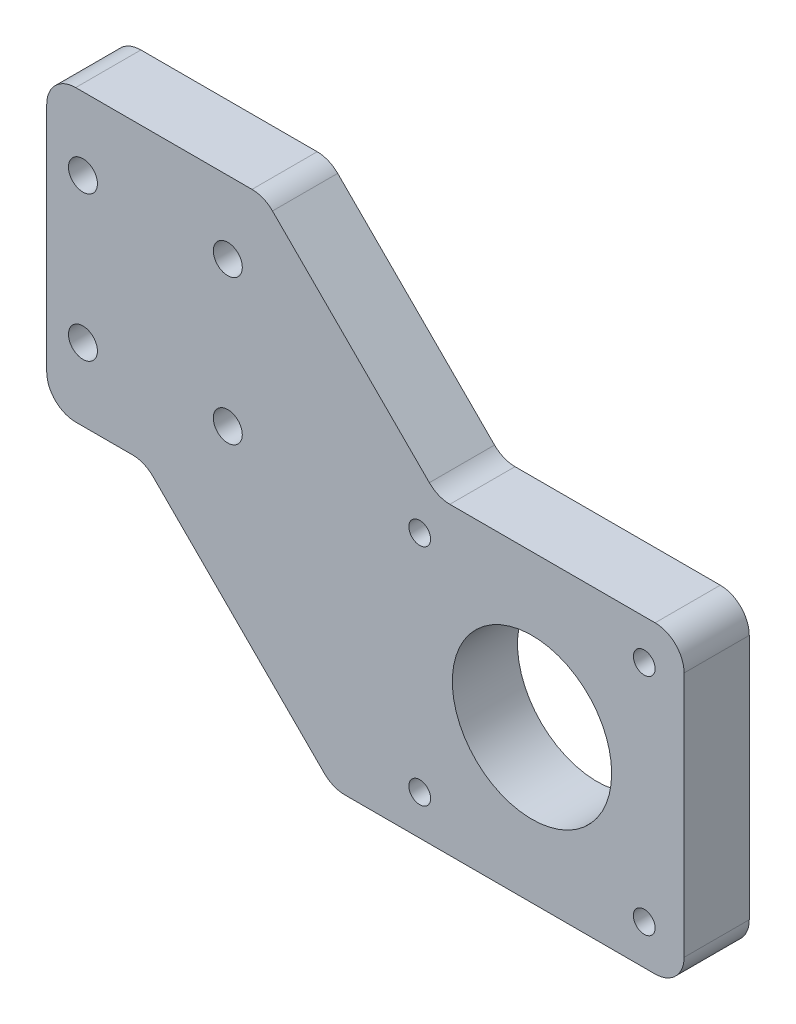
from build123d import *

# Parameters (mm, degrees)
ESQUISSE1_W             = 88
ESQUISSE1_H             = 96
BOSS_EXTRU_1_DEPTH      = 9
ESQUISSE2_R             = 2
ENL_V_MAT_EXTRU_1_DEPTH = 131.541181242
ESQUISSE3_R             = 1.5
ESQUISSE3_R_2           = 11
ENL_V_MAT_EXTRU_2_DEPTH = 131.541181242
ESQUISSE4_W             = 88
ESQUISSE4_H             = 28
ENL_V_MAT_EXTRU_3_DEPTH = 131.541181242
ENL_V_MAT_EXTRU_4_DEPTH = 9
ESQUISSE6_W             = 41.5
ESQUISSE6_H             = 28
ENL_V_MAT_EXTRU_5_DEPTH = 112.575086825
ESQUISSE7_W             = 46.5
ESQUISSE7_H             = 2
ENL_V_MAT_EXTRU_6_DEPTH = 112.575086825
CHANFREIN1_SIZE         = 28
CONG_1_R                = 4


with BuildPart() as part:
    # Esquisse1 → Boss.-Extru.1 (new body)
    with BuildSketch(Plane.XY):
        with Locations((44, 48)):
            Rectangle(ESQUISSE1_W, ESQUISSE1_H)
    extrude(amount=BOSS_EXTRU_1_DEPTH)

    # Esquisse2 → Enlèv. mat.-Extru.1 (cut, through all)
    with BuildSketch(Plane.XY.offset(9)):
        with Locations((5, 58)):
            Circle(ESQUISSE2_R)
        with Locations(Location((5, 38, 0), (0, 0, 180))):
            Circle(ESQUISSE2_R)
        with Locations((25, 38)):
            Circle(ESQUISSE2_R)
        with Locations(Location((25, 58, 0), (0, 0, 180))):
            Circle(ESQUISSE2_R)
    extrude(amount=-ENL_V_MAT_EXTRU_1_DEPTH, mode=Mode.SUBTRACT)

    # Esquisse3 → Enlèv. mat.-Extru.2 (cut, through all)
    with BuildSketch(Plane.XY.offset(9)):
        with Locations((82.5, 38.5)):
            Circle(ESQUISSE3_R)
        with Locations(Location((82.5, 7.5, 0), (0, 0, 180))):
            Circle(ESQUISSE3_R)
        with Locations((51.5, 7.5)):
            Circle(ESQUISSE3_R)
        with Locations(Location((51.5, 38.5, 0), (0, 0, 180))):
            Circle(ESQUISSE3_R)
        with Locations((67, 23)):
            Circle(ESQUISSE3_R_2)
    extrude(amount=-ENL_V_MAT_EXTRU_2_DEPTH, mode=Mode.SUBTRACT)

    # Esquisse4 → Enlèv. mat.-Extru.3 (cut, through all)
    with BuildSketch(Plane.XY.offset(9)):
        with Locations((44, 82)):
            Rectangle(ESQUISSE4_W, ESQUISSE4_H)
    extrude(amount=-ENL_V_MAT_EXTRU_3_DEPTH, mode=Mode.SUBTRACT)

    # Esquisse5 → Enlèv. mat.-Extru.4 (cut)
    with BuildSketch(Plane.XY.offset(9)):
        Polygon((30, 68), (54, 44), (88, 44), (88, 68), align=None)
    extrude(amount=-ENL_V_MAT_EXTRU_4_DEPTH, mode=Mode.SUBTRACT)

    # Esquisse6 → Enlèv. mat.-Extru.5 (cut, through all)
    with BuildSketch(Plane.XY.offset(9)):
        with Locations((20.75, 14)):
            Rectangle(ESQUISSE6_W, ESQUISSE6_H)
    extrude(amount=-ENL_V_MAT_EXTRU_5_DEPTH, mode=Mode.SUBTRACT)

    # Esquisse7 → Enlèv. mat.-Extru.6 (cut, through all)
    with BuildSketch(Plane.XY.offset(9)):
        with Locations((64.75, 1)):
            Rectangle(ESQUISSE7_W, ESQUISSE7_H)
    extrude(amount=-ENL_V_MAT_EXTRU_6_DEPTH, mode=Mode.SUBTRACT)

    # Chanfrein1
    # the kernel refuses this chamfer: 28 mm, written as the material it adds along each edge
    with BuildSketch(Plane(origin=(41.5, 28, 9), x_dir=(0.027495876610586358, -0.9996219169112968, 0), z_dir=(0, 0, -1))) as chanfrein1_piece_1_section:
        Polygon((CHANFREIN1_SIZE * 0.999621916911, CHANFREIN1_SIZE * 0.0274958766106), (-CHANFREIN1_SIZE * 0.0274958766106, CHANFREIN1_SIZE * 0.999621916911), (0, 0), align=None)
    chanfrein1_piece_1 = extrude(amount=9, mode=Mode.PRIVATE)
    chanfrein1_piece_1 = split(chanfrein1_piece_1, bisect_by=Plane(origin=(32.152400719, 2, 4.5), z_dir=(0, 1, 0)), keep=Keep.TOP, mode=Mode.PRIVATE)
    add(chanfrein1_piece_1)

    # Congé1
    cong_1_edges = [part.edges().sort_by_distance(p)[0] for p in [
        (88, 2, 4.5),
        (13.5, 28, 4.5),
        (39.5, 2, 4.5),
        (0, 68, 4.5),
        (30, 68, 4.5),
        (88, 44, 4.5),
        (54, 44, 4.5),
        (0, 28, 4.5),
    ]]
    fillet(cong_1_edges, radius=CONG_1_R)


solid = part.part
